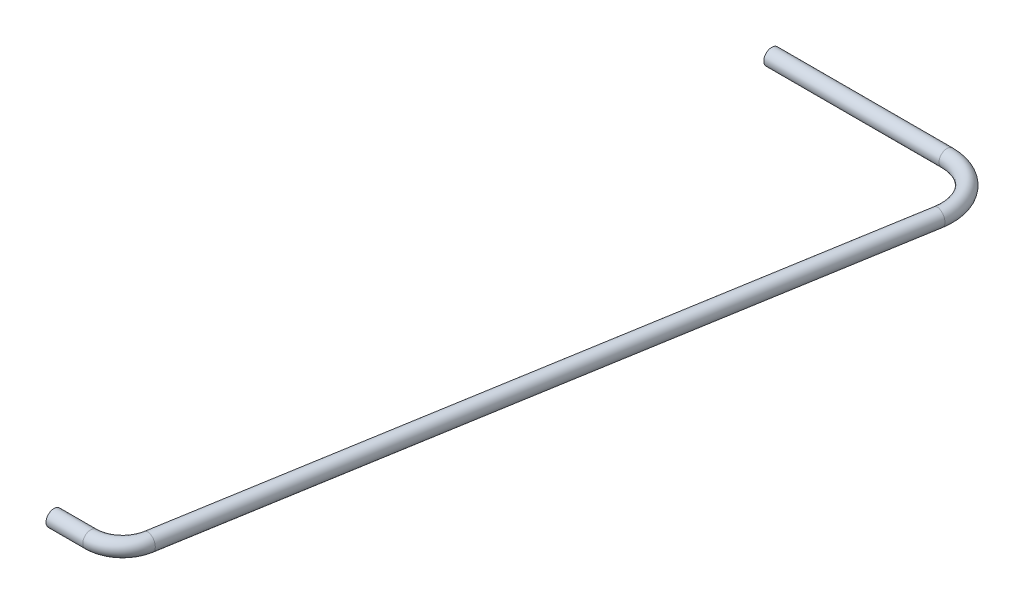
from build123d import *

# Parameters (mm, degrees)
SWEEP1_PROFILE_R = 2.5


with BuildPart() as part:
    # Sweep1: sweep along a path in Sketch1
    with BuildLine(Plane(origin=(0, 0, 0), x_dir=(1, 0, 0), z_dir=(0, 1, 0))) as sweep1_path:
        Line((-5, 0), (6.540814681, 0))
        ThreePointArc((6.540814681, 0), (12.999190071, 2.365251325), (16.402429271, 8.342122535))
        Line((16.402429271, 8.342122535), (52.060217854, 220.446681282))
        ThreePointArc((52.060217854, 220.446681282), (48.719918981, 232.621060564), (37.267795969, 237.93349748))
        Line((37.267795969, 237.93349748), (-17.732204031, 237.93349748))
    # Sweep1 profile (on start of the path) → Sweep1 (sweep)
    with BuildSketch(Plane(origin=(-5, 0, 0), x_dir=(0, 0, 1), z_dir=(1, 0, 0))):
        Circle(SWEEP1_PROFILE_R)
    sweep(path=sweep1_path.line)


solid = part.part
